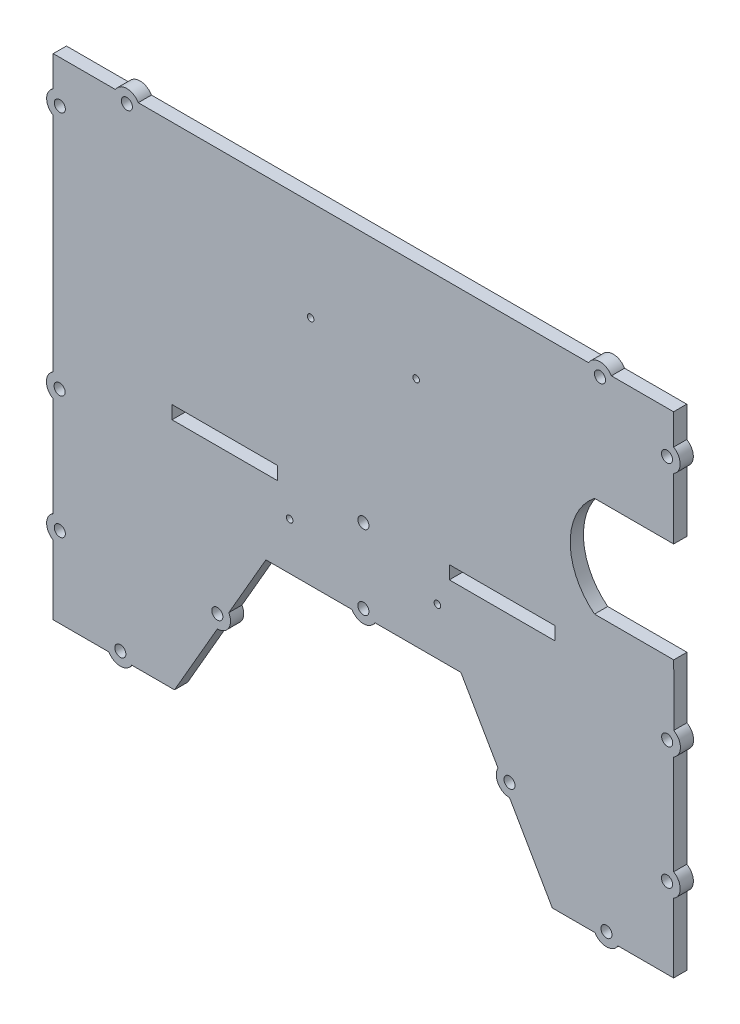
from build123d import *

# Parameters (mm, degrees)
BOSS_EXTRUDE2_DEPTH  = 5
CUT_EXTRUDE1_START   = -5
CUT_EXTRUDE1_DEPTH   = 5
BOSS_EXTRUDE4_DEPTH  = 5
BOSS_EXTRUDE6_DEPTH  = 5
SKETCH7_R            = 2.1
CUT_EXTRUDE3_DEPTH   = 5
CUT_EXTRUDE7_START   = -5
CUT_EXTRUDE7_DEPTH   = 5
BOSS_EXTRUDE9_START  = -5
BOSS_EXTRUDE9_DEPTH  = 5
CUT_EXTRUDE10_DEPTH  = 5
SKETCH18_R           = 2.1
BOSS_EXTRUDE12_DEPTH = 5
BOSS_EXTRUDE13_DEPTH = 5
SKETCH21_W           = 5
SKETCH21_H           = 8.660255075
BOSS_EXTRUDE15_DEPTH = 0.3
CUT_EXTRUDE12_DEPTH  = 5
BOSS_EXTRUDE16_DEPTH = 5
BOSS_EXTRUDE17_DEPTH = 5
CUT_EXTRUDE13_DEPTH  = 5
SKETCH26_R           = 2.1
CUT_EXTRUDE14_DEPTH  = 5
CUT_EXTRUDE15_DEPTH  = 5
SKETCH28_R           = 2.1
BOSS_EXTRUDE18_DEPTH = 5
BOSS_EXTRUDE22_START = -5
BOSS_EXTRUDE22_DEPTH = 5
SKETCH31_R           = 2.1
CUT_EXTRUDE16_DEPTH  = 5
CUT_EXTRUDE17_DEPTH  = 5
SKETCH33_R           = 5
BOSS_EXTRUDE23_DEPTH = 5
SKETCH34_R           = 2.1
CUT_EXTRUDE18_DEPTH  = 5
SKETCH35_R           = 2.1
SKETCH35_W           = 40
SKETCH35_H           = 5
CUT_EXTRUDE19_DEPTH  = 5
SKETCH36_W           = 5
SKETCH36_H           = 84.289880446
BOSS_EXTRUDE24_DEPTH = 15
SKETCH38_R           = 1.25
CUT_EXTRUDE20_DEPTH  = 15
CUT_EXTRUDE22_DEPTH  = 15
SKETCH41_W           = 235.10328775
SKETCH41_H           = 5
CUT_EXTRUDE23_DEPTH  = 5
SKETCH42_W           = 21.47370592
SKETCH42_H           = 11.045026483
CUT_EXTRUDE24_DEPTH  = 5
BOSS_EXTRUDE25_DEPTH = 5
SKETCH44_R           = 2.1
CUT_EXTRUDE25_DEPTH  = 5


with BuildPart() as part:
    # Sketch1 → Boss-Extrude2 (new body)
    with BuildSketch(Plane.XY):
        with BuildLine():
            Line((-117.909641201, -61.899813743), (-117.909641201, -75.46379791))
            ThreePointArc((-117.909641201, -75.46379791), (-120.409641201, -79.793924929), (-117.909641201, -84.124051948))
            Line((-117.909641201, -84.124051948), (-117.909641201, -97.688036115))
            Line((-117.909641201, -97.688036115), (-104.194704325, -106.486172223))
            ThreePointArc((-104.194704325, -106.486172223), (-101.899920025, -110.928464988), (-96.905389489, -111.162269871))
            Line((-96.905389489, -111.162269871), (-86.732726665, -117.688036115))
            Line((-86.732726665, -117.688036115), (-46.516437834, -117.688036115))
            ThreePointArc((-46.516437834, -117.688036115), (-42.186310815, -120.188036115), (-37.856183796, -117.688036115))
            Line((-37.856183796, -117.688036115), (37.176901394, -117.688036115))
            ThreePointArc((37.176901394, -117.688036115), (41.507028413, -120.188036115), (45.837155432, -117.688036115))
            Line((45.837155432, -117.688036115), (86.053444263, -117.688036115))
            Line((86.053444263, -117.688036115), (96.226107086, -111.162269871))
            ThreePointArc((96.226107086, -111.162269871), (101.220637622, -110.928464988), (103.515421923, -106.486172223))
            Line((103.515421923, -106.486172223), (117.230358799, -97.688036115))
            Line((117.230358799, -97.688036115), (117.230358799, -84.124051948))
            ThreePointArc((117.230358799, -84.124051948), (119.730358799, -79.793924929), (117.230358799, -75.46379791))
            Line((117.230358799, -75.46379791), (117.230358799, -61.899813743))
            ThreePointArc((117.230358799, -61.899813743), (115.765892705, -58.364279837), (112.230358799, -56.899813743))
            Line((112.230358799, -56.899813743), (107.230252822, -56.899813743))
            ThreePointArc((107.230252822, -56.899813743), (103.694756385, -55.435385117), (102.230252824, -51.89991972))
            Line((102.230252824, -51.89991972), (102.22876914, 18.10008028))
            ThreePointArc((102.22876914, 18.10008028), (103.693197764, 21.635682694), (107.228769139, 23.100186257))
            Line((107.228769139, 23.100186257), (112.224422266, 23.100186257))
            ThreePointArc((112.224422266, 23.100186257), (115.761454601, 24.566151415), (117.224420469, 28.104425352))
            Line((117.224420469, 28.104425352), (117.198504049, 58.672752041))
            ThreePointArc((117.198504049, 58.672752041), (119.694832884, 63.004997571), (117.19116172, 67.333004004))
            Line((117.19116172, 67.333004004), (117.165248894, 97.897091598))
            ThreePointArc((117.165248894, 97.897091598), (115.8233862, 102.892284122), (112.165252488, 106.548867445))
            Line((112.165252488, 106.548867445), (88.414612972, 120.261305563))
            ThreePointArc((88.414612972, 120.261305563), (86.002803423, 121.260309788), (83.414612972, 121.601051525))
            Line((83.414612972, 121.601051525), (-84.093895374, 121.601051525))
            ThreePointArc((-84.093895374, 121.601051525), (-86.682085825, 121.260309788), (-89.093895374, 120.261305563))
            Line((-89.093895374, 120.261305563), (-112.84453489, 106.548867445))
            ThreePointArc((-112.84453489, 106.548867445), (-116.502668602, 102.892284122), (-117.844531296, 97.897091598))
            Line((-117.844531296, 97.897091598), (-117.870444122, 67.333004004))
            ThreePointArc((-117.870444122, 67.333004004), (-120.374115287, 63.004997571), (-117.877786452, 58.672752041))
            Line((-117.877786452, 58.672752041), (-117.903702872, 28.104425352))
            ThreePointArc((-117.903702872, 28.104425352), (-116.440737003, 24.566151415), (-112.903704669, 23.100186257))
            Line((-112.903704669, 23.100186257), (-107.908051541, 23.100186257))
            ThreePointArc((-107.908051541, 23.100186257), (-104.372480167, 21.635682694), (-102.908051542, 18.10008028))
            Line((-102.908051542, 18.10008028), (-102.909535226, -51.89991972))
            ThreePointArc((-102.909535226, -51.89991972), (-104.374038788, -55.435385117), (-107.909535225, -56.899813743))
            Line((-107.909535225, -56.899813743), (-112.909641201, -56.899813743))
            ThreePointArc((-112.909641201, -56.899813743), (-116.445175107, -58.364279837), (-117.909641201, -61.899813743))
        make_face()
    extrude(amount=BOSS_EXTRUDE2_DEPTH)

    # Sketch2 → Cut-Extrude1 (cut)
    with BuildSketch(Plane.XY.offset(5).offset(CUT_EXTRUDE1_START)):
        with BuildLine():
            Line((82.551631294, 83.23178077), (112.19953348, 66.114556461))
            ThreePointArc((112.19953348, 66.114556461), (115.857667192, 62.457973139), (117.199529886, 57.462780614))
            Line((117.199529886, 57.462780614), (117.198504049, 58.672752041))
            ThreePointArc((117.198504049, 58.672752041), (119.694832884, 63.004997571), (117.19116172, 67.333004004))
            Line((117.19116172, 67.333004004), (117.165248894, 97.897091598))
            ThreePointArc((117.165248894, 97.897091598), (115.8233862, 102.892284122), (112.165252488, 106.548867445))
            Line((112.165252488, 106.548867445), (88.414612972, 120.261305563))
            ThreePointArc((88.414612972, 120.261305563), (86.002803423, 121.260309788), (83.414612972, 121.601051525))
            Line((83.414612972, 121.601051525), (-84.093895374, 121.601051525))
            ThreePointArc((-84.093895374, 121.601051525), (-86.682085825, 121.260309788), (-89.093895374, 120.261305563))
            Line((-89.093895374, 120.261305563), (-112.84453489, 106.548867445))
            ThreePointArc((-112.84453489, 106.548867445), (-116.502668602, 102.892284122), (-117.844531296, 97.897091598))
            Line((-117.844531296, 97.897091598), (-117.870444122, 67.333004004))
            ThreePointArc((-117.870444122, 67.333004004), (-120.374115287, 63.004997571), (-117.877786452, 58.672752041))
            Line((-117.877786452, 58.672752041), (-117.878812289, 57.462780614))
            ThreePointArc((-117.878812289, 57.462780614), (-116.536949595, 62.457973139), (-112.878815883, 66.114556461))
            Line((-112.878815883, 66.114556461), (-83.230913696, 83.23178077))
            ThreePointArc((-83.230913696, 83.23178077), (-80.819104147, 84.230784995), (-78.230913696, 84.571526732))
            Line((-78.230913696, 84.571526732), (77.551631294, 84.571526732))
            ThreePointArc((77.551631294, 84.571526732), (80.139821745, 84.230784995), (82.551631294, 83.23178077))
        make_face()
    extrude(amount=CUT_EXTRUDE1_DEPTH, mode=Mode.SUBTRACT)

    # Sketch5 → Boss-Extrude4 (add)
    with BuildSketch(Plane.XY.offset(5)):
        Polygon((117.224420469, 28.104425352), (117.230358799, -61.899813743), (97.020135534, -61.899813743), (97.020135534, 28.104425352), align=None)
        Polygon((-117.903702872, 28.104425352), (-117.909641201, -61.899813743), (-99.161276446, -61.899813743), (-99.161276446, 28.104425352), align=None)
    extrude(amount=-BOSS_EXTRUDE4_DEPTH)


with BuildPart() as boss_extrude6_tool:
    # Sketch6 → Boss-Extrude6 (new body)
    with BuildSketch(Plane.XY.offset(5)):
        with BuildLine():
            Line((117.229676096, -51.549775852), (117.229104854, -42.889521827))
            ThreePointArc((117.229104854, -42.889521827), (119.729390475, -47.219483936), (117.229676096, -51.549775852))
        make_face()
        with BuildLine():
            Line((-117.908958499, -51.549775852), (-117.908387257, -42.889521827))
            ThreePointArc((-117.908387257, -42.889521827), (-120.408672878, -47.219483936), (-117.908958499, -51.549775852))
        make_face()
    extrude(amount=-BOSS_EXTRUDE6_DEPTH)


with BuildPart() as part_1:
    add(part.part)


with BuildPart() as part_2:
    # Boss-Extrude6: joined with boss_extrude6_tool
    add(part_1.part.fuse(boss_extrude6_tool.part, tol=0.00001))

    # Sketch7 → Cut-Extrude3 (cut)
    with BuildSketch(Plane.XY.offset(5)):
        with Locations((-115.408672889, -47.219813743)):
            Circle(SKETCH7_R)
        with Locations((114.729390486, -47.219813743)):
            Circle(SKETCH7_R)
    extrude(amount=-CUT_EXTRUDE3_DEPTH, mode=Mode.SUBTRACT)

    # Sketch12 → Cut-Extrude7 (cut)
    with BuildSketch(Plane.XY.offset(5).offset(CUT_EXTRUDE7_START)):
        with BuildLine():
            Line((-80.430890219, 57.295225551), (-117.878981263, 57.263476303))
            Line((-117.878981263, 57.263476303), (-117.878812289, 57.462780614))
            ThreePointArc((-117.878812289, 57.462780614), (-116.536949595, 62.457973139), (-112.878815883, 66.114556461))
            Line((-112.878815883, 66.114556461), (-83.230913696, 83.23178077))
            ThreePointArc((-83.230913696, 83.23178077), (-80.819104147, 84.230784995), (-78.230913696, 84.571526732))
            Line((-78.230913696, 84.571526732), (77.551631294, 84.571526732))
            ThreePointArc((77.551631294, 84.571526732), (80.139821745, 84.230784995), (82.551631294, 83.23178077))
            Line((82.551631294, 83.23178077), (112.19953348, 66.114556461))
            ThreePointArc((112.19953348, 66.114556461), (115.857667192, 62.457973139), (117.199529886, 57.462780614))
            Line((117.199529886, 57.462780614), (77.975136294, 57.429525381))
            Line((77.975136294, 57.429525381), (-80.430890219, 57.295225551))
        make_face()
    extrude(amount=CUT_EXTRUDE7_DEPTH, mode=Mode.SUBTRACT)

    # Boss-Extrude9: read off the stored shape, not the designer's step
    # Boss-Extrude9 outline → Boss-Extrude9 (add)
    with BuildSketch(Plane.XY.offset(5).offset(BOSS_EXTRUDE9_START)):
        with BuildLine():
            Line((-117.909641201, -97.688036115), (-117.909641201, -147.554211412))
            Line((-117.909641201, -147.554211412), (-57.839641201, -147.554211412))
            Line((-57.839641201, -147.554211412), (-27.973465904, -117.688036115))
            Line((-27.973465904, -117.688036115), (-37.856183796, -117.688036115))
            ThreePointArc((-37.856183796, -117.688036115), (-42.186310815, -120.188036115), (-46.516437834, -117.688036115))
            Line((-46.516437834, -117.688036115), (-86.732726665, -117.688036115))
            Line((-86.732726665, -117.688036115), (-96.905389489, -111.162269871))
            ThreePointArc((-96.905389489, -111.162269871), (-101.899920025, -110.928464988), (-104.194704325, -106.486172223))
            Line((-104.194704325, -106.486172223), (-117.909641201, -97.688036115))
        make_face()
        with BuildLine():
            Line((-83.230913696, 83.23178077), (-112.878815883, 66.114556461))
            ThreePointArc((-112.878815883, 66.114556461), (-116.536949595, 62.457973139), (-117.878812289, 57.462780614))
            Line((-117.878812289, 57.462780614), (-117.878981263, 57.263476303))
            Line((-117.878981263, 57.263476303), (117.199529886, 57.462780614))
            ThreePointArc((117.199529886, 57.462780614), (115.857667192, 62.457973139), (112.19953348, 66.114556461))
            Line((112.19953348, 66.114556461), (82.551631294, 83.23178077))
            ThreePointArc((82.551631294, 83.23178077), (80.139821745, 84.230784995), (77.551631294, 84.571526732))
            Line((77.551631294, 84.571526732), (-78.230913696, 84.571526732))
            ThreePointArc((-78.230913696, 84.571526732), (-80.819104147, 84.230784995), (-83.230913696, 83.23178077))
        make_face()
    extrude(amount=BOSS_EXTRUDE9_DEPTH)

    # Sketch17 → Cut-Extrude10 (cut)
    with BuildSketch(Plane.XY.offset(5)):
        with BuildLine():
            Line((-117.909641201, -84.124051948), (-117.909641201, -75.46379791))
            ThreePointArc((-117.909641201, -75.46379791), (-120.409641201, -79.793924929), (-117.909641201, -84.124051948))
        make_face()
        with BuildLine():
            Line((-117.908958323, -51.549775852), (-117.908387257, -42.889521827))
            ThreePointArc((-117.908387257, -42.889521827), (-120.408672878, -47.219484012), (-117.908958323, -51.549775852))
        make_face()
        with BuildLine():
            Line((117.229104531, -42.889521827), (117.229676096, -51.549775852))
            ThreePointArc((117.229676096, -51.549775852), (119.729390475, -47.219483796), (117.229104531, -42.889521827))
        make_face()
        with BuildLine():
            Line((117.230358799, -75.46379791), (117.230358799, -84.124051948))
            ThreePointArc((117.230358799, -84.124051948), (119.730358799, -79.793924929), (117.230358799, -75.46379791))
        make_face()
    extrude(amount=-CUT_EXTRUDE10_DEPTH, mode=Mode.SUBTRACT)

    # Sketch18 → Boss-Extrude12 (add)
    with BuildSketch(Plane.XY.offset(5)):
        with Locations((114.729390486, -47.219813743)):
            Circle(SKETCH18_R)
        with Locations((-115.408672889, -47.219813743)):
            Circle(SKETCH18_R)
    extrude(amount=-BOSS_EXTRUDE12_DEPTH)

    # Sketch19 → Boss-Extrude13 (add)
    with BuildSketch(Plane.XY.offset(5)):
        with BuildLine():
            Line((-117.908033697, -37.535691027), (-117.908609204, -46.258353482))
            ThreePointArc((-117.908609204, -46.258353482), (-120.463165041, -41.89685369), (-117.908033697, -37.535691027))
        make_face()
        with BuildLine():
            Line((-117.892209168, 41.795033425), (-117.899551497, 33.134781462))
            ThreePointArc((-117.899551497, 33.134781462), (-120.395880333, 37.467026992), (-117.892209168, 41.795033425))
        make_face()
        with BuildLine():
            ThreePointArc((117.212926765, 41.795033425), (119.71659793, 37.467026992), (117.220269095, 33.134781462))
            Line((117.220269095, 33.134781462), (117.212926765, 41.795033425))
        make_face()
        with BuildLine():
            Line((117.280209688, -37.564938053), (117.287552017, -46.225190016))
            ThreePointArc((117.287552017, -46.225190016), (119.783880852, -41.892944486), (117.280209688, -37.564938053))
        make_face()
        with BuildLine():
            Line((117.230358799, -100.329973207), (117.230358799, -108.990227245))
            ThreePointArc((117.230358799, -108.990227245), (119.730358799, -104.660100226), (117.230358799, -100.329973207))
        make_face()
        with BuildLine():
            Line((-117.909641201, -100.329973207), (-117.909641201, -108.990227245))
            ThreePointArc((-117.909641201, -108.990227245), (-120.409641201, -104.660100226), (-117.909641201, -100.329973207))
        make_face()
    extrude(amount=-BOSS_EXTRUDE13_DEPTH)


with BuildPart() as boss_extrude13_piece_1:
    # of the separate pieces the step leaves, piece 1, a body of its own (boss_extrude13_pieces)
    add(part_2.part.solids().sort_by_distance((-117.878981263, 57.263476303, 0))[0])



with BuildPart() as boss_extrude13_piece_2:
    # of the separate pieces the step leaves, piece 2, a body of its own (boss_extrude13_pieces)
    add(part_2.part.solids().sort_by_distance((117.212926765, 41.795033425, 5))[0])


with BuildPart() as boss_extrude13_piece_3:
    # of the separate pieces the step leaves, piece 3, a body of its own (boss_extrude13_pieces)
    add(part_2.part.solids().sort_by_distance((-117.892209168, 41.795033425, 5))[0])


with BuildPart() as boss_extrude13_piece_4:
    # of the separate pieces the step leaves, piece 4, a body of its own (boss_extrude13_pieces)
    add(part_2.part.solids().sort_by_distance((117.280209688, -37.564938053, 5))[0])


with BuildPart() as boss_extrude13_piece_5:
    # of the separate pieces the step leaves, piece 5, a body of its own (boss_extrude13_pieces)
    add(part_2.part.solids().sort_by_distance((117.230358799, -100.329973207, 5))[0])


with BuildPart() as boss_extrude13_piece_1_1:
    add(boss_extrude13_piece_1.part)

    add(boss_extrude13_piece_4.part)  # Boss-Extrude15 merges Boss-Extrude13 piece 4
    # Sketch21 → Boss-Extrude15 (add)
    with BuildSketch(Plane(origin=(117.248277127, 0.099405362, 0), x_dir=(0, 0, 1), z_dir=(-0.999999640601339, -0.0008478190804545042, 0))):
        with Locations((2.5, -41.99448449)):
            Rectangle(SKETCH21_W, SKETCH21_H)
    extrude(amount=BOSS_EXTRUDE15_DEPTH)

    # Sketch23 → Boss-Extrude16 (add)
    with BuildSketch(Plane.XY.offset(5)):
        with BuildLine():
            Line((117.220155691, 33.134715862), (117.212813251, 41.795098832))
            ThreePointArc((117.212813251, 41.795098832), (119.71659793, 37.467026992), (117.220155691, 33.134715862))
        make_face()
        with BuildLine():
            Line((-117.892095653, 41.795098832), (-117.899438094, 33.134715862))
            ThreePointArc((-117.899438094, 33.134715862), (-120.395880333, 37.467026992), (-117.892095653, 41.795098832))
        make_face()
    extrude(amount=-BOSS_EXTRUDE16_DEPTH)


    add(boss_extrude13_piece_5.part)  # Boss-Extrude17 merges Boss-Extrude13 piece 5
    # Sketch24 → Boss-Extrude17 (add)
    with BuildSketch(Plane.XY.offset(5)):
        with BuildLine():
            Line((103.515421923, -106.486172223), (117.230358799, -97.688036115))
            Line((117.230358799, -97.688036115), (117.230358799, -145.602272977))
            Line((117.230358799, -145.602272977), (71.251792179, -145.602272977))
            Line((71.251792179, -145.602272977), (55.17186758, -117.688036115))
            Line((55.17186758, -117.688036115), (86.053444263, -117.688036115))
            Line((86.053444263, -117.688036115), (96.226107086, -111.162269871))
            ThreePointArc((96.226107086, -111.162269871), (101.220637622, -110.928464988), (103.515421923, -106.486172223))
        make_face()
    extrude(amount=-BOSS_EXTRUDE17_DEPTH)

    # Sketch25 → Cut-Extrude13 (cut)
    with BuildSketch(Plane(origin=(0, 0, 0), x_dir=(-1, 0, 0), z_dir=(0, 0, -1))):
        Polygon((-36.610776027, -85.602272977), (37.290058429, -85.602272977), (71.93107458, -145.602272977), (117.909641201, -145.602272977), (117.909641201, -153.53940599), (-71.251792179, -153.53940599), (-71.251792179, -145.602272977), align=None)
    extrude(amount=-CUT_EXTRUDE13_DEPTH, mode=Mode.SUBTRACT)

    # Sketch26 → Cut-Extrude14 (cut)
    with BuildSketch(Plane.XY.offset(5)):
        with Locations((114.716599727, 37.462787896)):
            Circle(SKETCH26_R)
        with Locations((114.783882649, -41.897183582)):
            Circle(SKETCH26_R)
        with Locations((114.730358799, -104.660100226)):
            Circle(SKETCH26_R)
        with Locations((-115.409641201, -104.660100226)):
            Circle(SKETCH26_R)
        with Locations((-115.463165052, -41.897183582)):
            Circle(SKETCH26_R)
        with Locations((-115.39588213, 37.462787896)):
            Circle(SKETCH26_R)
    extrude(amount=-CUT_EXTRUDE14_DEPTH, mode=Mode.SUBTRACT)

    # Sketch27 → Cut-Extrude15 (cut)
    with BuildSketch(Plane.XY.offset(5)):
        with BuildLine():
            Line((-117.892095653, 41.795098832), (-117.899438094, 33.134715862))
            ThreePointArc((-117.899438094, 33.134715862), (-120.395880333, 37.467026992), (-117.892095653, 41.795098832))
        make_face()
        with BuildLine():
            Line((-117.908033697, -37.535691027), (-117.908609204, -46.258353482))
            ThreePointArc((-117.908609204, -46.258353482), (-120.463165041, -41.89685369), (-117.908033697, -37.535691027))
        make_face()
        with BuildLine():
            Line((-117.909641201, -100.329973207), (-117.909641201, -108.990227245))
            ThreePointArc((-117.909641201, -108.990227245), (-120.409641201, -104.660100226), (-117.909641201, -100.329973207))
        make_face()
        with BuildLine():
            Line((117.230358799, -108.990227245), (117.230358799, -100.329973207))
            ThreePointArc((117.230358799, -100.329973207), (119.730358799, -104.660100226), (117.230358799, -108.990227245))
        make_face()
        with BuildLine():
            Line((117.287552017, -46.225190016), (117.280209688, -37.564938053))
            ThreePointArc((117.280209688, -37.564938053), (119.783880852, -41.892944486), (117.287552017, -46.225190016))
        make_face()
        with BuildLine():
            Line((117.220155691, 33.134715862), (117.212813251, 41.795098832))
            ThreePointArc((117.212813251, 41.795098832), (119.71659793, 37.467026992), (117.220155691, 33.134715862))
        make_face()
    extrude(amount=-CUT_EXTRUDE15_DEPTH, mode=Mode.SUBTRACT)

    # Sketch28 → Boss-Extrude18 (add)
    with BuildSketch(Plane.XY.offset(5)):
        with Locations((114.716599727, 37.462787896)):
            Circle(SKETCH28_R)
        with Locations((114.783882649, -41.897183582)):
            Circle(SKETCH28_R)
        with Locations((114.730358799, -104.660100226)):
            Circle(SKETCH28_R)
        with Locations((-115.409641201, -104.660100226)):
            Circle(SKETCH28_R)
        with Locations((-115.463165052, -41.897183582)):
            Circle(SKETCH28_R)
        with Locations((-115.39588213, 37.462787896)):
            Circle(SKETCH28_R)
    extrude(amount=-BOSS_EXTRUDE18_DEPTH)


with BuildPart() as cut_extrude12_tool:
    # Sketch22 → Cut-Extrude12 (new body)
    with BuildSketch(Plane.XY.offset(5)):
        with BuildLine():
            Line((117.212926765, 41.795033425), (117.220269095, 33.134781462))
            ThreePointArc((117.220269095, 33.134781462), (119.71659793, 37.467026992), (117.212926765, 41.795033425))
        make_face()
        with BuildLine():
            Line((-117.899551497, 33.134781462), (-117.892209168, 41.795033425))
            ThreePointArc((-117.892209168, 41.795033425), (-120.395880333, 37.467026992), (-117.899551497, 33.134781462))
        make_face()
    extrude(amount=-CUT_EXTRUDE12_DEPTH)


with BuildPart() as boss_extrude13_piece_2_1:
    add(boss_extrude13_piece_2.part)

    # Cut-Extrude12: cut by cut_extrude12_tool
    add(cut_extrude12_tool.part, mode=Mode.SUBTRACT)


with BuildPart() as boss_extrude13_piece_3_1:
    add(boss_extrude13_piece_3.part)

    # Cut-Extrude12: cut by cut_extrude12_tool
    add(cut_extrude12_tool.part, mode=Mode.SUBTRACT)


with BuildPart() as boss_extrude22_tool:
    # Boss-Extrude22: read off the stored shape, not the designer's step
    # Boss-Extrude22 outline → Boss-Extrude22 (new body)
    with BuildSketch(Plane.XY.offset(5).offset(BOSS_EXTRUDE22_START)):
        with BuildLine():
            ThreePointArc((117.224955254, 19.998970189), (119.711277501, 24.320722052), (117.225732273, 28.642920844))
            Line((117.225732273, 28.642920844), (117.224420469, 28.104425352))
            ThreePointArc((117.224420469, 28.104425352), (117.224421744, 28.102470751), (117.224422255, 28.100516149))
            Line((117.224422255, 28.100516149), (117.224955254, 19.998970189))
        make_face()
        with BuildLine():
            Line((117.230358799, -110.767851006), (117.230358799, -119.428105044))
            ThreePointArc((117.230358799, -119.428105044), (119.730358799, -115.097978025), (117.230358799, -110.767851006))
        make_face()
        with BuildLine():
            ThreePointArc((87.45523178, -145.602272977), (91.785358799, -148.102272977), (96.115485818, -145.602272977))
            Line((96.115485818, -145.602272977), (87.45523178, -145.602272977))
        make_face()
        with BuildLine():
            Line((55.024839537, -117.496366549), (50.694712518, -109.996366549))
            ThreePointArc((50.694712518, -109.996366549), (50.694712517, -114.996366549), (55.024839537, -117.496366549))
        make_face()
        with BuildLine():
            ThreePointArc((-117.909641201, -110.767145958), (-120.409641201, -115.097272977), (-117.909641201, -119.427399996))
            Line((-117.909641201, -119.427399996), (-117.909641201, -110.767145958))
        make_face()
        with BuildLine():
            ThreePointArc((-96.79476822, -145.602272977), (-92.464641201, -148.102272977), (-88.134514182, -145.602272977))
            Line((-88.134514182, -145.602272977), (-96.79476822, -145.602272977))
        make_face()
        with BuildLine():
            ThreePointArc((-55.704121939, -117.496366549), (-51.37399492, -114.996366549), (-51.37399492, -109.996366549))
            Line((-51.37399492, -109.996366549), (-55.704121939, -117.496366549))
        make_face()
        with BuildLine():
            ThreePointArc((-4.669559606, -85.602272977), (-0.339432587, -88.102272977), (3.990694432, -85.602272977))
            Line((3.990694432, -85.602272977), (-4.669559606, -85.602272977))
        make_face()
        with BuildLine():
            Line((-117.903702872, 28.104425352), (-117.903241172, 28.648998661))
            ThreePointArc((-117.903241172, 28.648998661), (-120.399261875, 24.321747367), (-117.904237989, 19.993921248))
            Line((-117.904237989, 19.993921248), (-117.903704658, 28.100516149))
            ThreePointArc((-117.903704658, 28.100516149), (-117.903704147, 28.102470751), (-117.903702872, 28.104425352))
        make_face()
    extrude(amount=BOSS_EXTRUDE22_DEPTH)


with BuildPart() as boss_extrude13_piece_1_2:
    add(boss_extrude13_piece_1_1.part)


with BuildPart() as boss_extrude13_piece_1_3:
    # Boss-Extrude22: joined with boss_extrude22_tool
    add(boss_extrude13_piece_1_2.part.fuse(boss_extrude22_tool.part, tol=0.00001))

    # Sketch31 → Cut-Extrude16 (cut)
    with BuildSketch(Plane.XY.offset(5)):
        with Locations((-115.399261908, 24.32117151)):
            Circle(SKETCH31_R)
        with Locations((-92.464641201, -143.102272977)):
            Circle(SKETCH31_R)
        with Locations((-55.704121939, -112.496366549)):
            Circle(SKETCH31_R)
        with Locations((-0.339432587, -83.102272977)):
            Circle(SKETCH31_R)
        with Locations((55.024839536, -112.496366549)):
            Circle(SKETCH31_R)
        with Locations((114.730358799, -115.097978025)):
            Circle(SKETCH31_R)
        with Locations((114.711277521, 24.32117151)):
            Circle(SKETCH31_R)
        with Locations((91.785358799, -143.102272977)):
            Circle(SKETCH31_R)
        with Locations((-115.409641201, -115.097272977)):
            Circle(SKETCH31_R)
    extrude(amount=-CUT_EXTRUDE16_DEPTH, mode=Mode.SUBTRACT)

    # Sketch32 → Cut-Extrude17 (cut)
    with BuildSketch(Plane.XY.offset(5)):
        with BuildLine():
            Line((-117.889165528, 45.25117151), (-79.540559924, 45.25117151))
            Line((-79.540559924, 45.25117151), (117.209883125, 45.25117151))
            Line((117.209883125, 45.25117151), (117.199529886, 57.462780614))
            ThreePointArc((117.199529886, 57.462780614), (115.857667192, 62.457973139), (112.19953348, 66.114556461))
            Line((112.19953348, 66.114556461), (82.551631294, 83.23178077))
            ThreePointArc((82.551631294, 83.23178077), (80.139821745, 84.230784995), (77.551631294, 84.571526732))
            Line((77.551631294, 84.571526732), (-78.230913696, 84.571526732))
            ThreePointArc((-78.230913696, 84.571526732), (-80.819104147, 84.230784995), (-83.230913696, 83.23178077))
            Line((-83.230913696, 83.23178077), (-112.878815883, 66.114556461))
            ThreePointArc((-112.878815883, 66.114556461), (-116.536949595, 62.457973139), (-117.878812289, 57.462780614))
            Line((-117.878812289, 57.462780614), (-117.889165528, 45.25117151))
        make_face()
    extrude(amount=-CUT_EXTRUDE17_DEPTH, mode=Mode.SUBTRACT)

    # Sketch33 → Boss-Extrude23 (add)
    with BuildSketch(Plane.XY.offset(5)):
        with Locations((114.808231898, -68.665098892)):
            Circle(SKETCH33_R)
        with Locations((-115.487097072, -68.665098892)):
            Circle(SKETCH33_R)
    extrude(amount=-BOSS_EXTRUDE23_DEPTH)

    # Sketch34 → Cut-Extrude18 (cut)
    with BuildSketch(Plane.XY.offset(5)):
        with Locations((-115.487097072, -68.665098892)):
            Circle(SKETCH34_R)
        with Locations((114.808231898, -68.665098892)):
            Circle(SKETCH34_R)
    extrude(amount=-CUT_EXTRUDE18_DEPTH, mode=Mode.SUBTRACT)

    # Sketch35 → Cut-Extrude19 (cut)
    with BuildSketch(Plane.XY.offset(5)):
        with Locations((-0.325135338, -54.922272977)):
            Circle(SKETCH35_R)
        with Locations((-52.880135338, -54.922272977)):
            Rectangle(SKETCH35_W, SKETCH35_H)
        with Locations((52.229864662, -54.922272977)):
            Rectangle(SKETCH35_W, SKETCH35_H)
    extrude(amount=-CUT_EXTRUDE19_DEPTH, mode=Mode.SUBTRACT)

    # Sketch36 → Boss-Extrude24 (add)
    with BuildSketch(Plane(origin=(117.248277127, 0.099405362, 0), x_dir=(0, 0, -1), z_dir=(0.999999640601339, 0.0008478190804503918, 0))):
        with Locations((-2.5, -22.245362775)):
            Rectangle(SKETCH36_W, SKETCH36_H)
    extrude(amount=-BOSS_EXTRUDE24_DEPTH)

    # Sketch38 → Cut-Extrude20 (cut)
    with BuildSketch(Plane.XY.offset(5)):
        with Locations((19.67048227, 2.30323698)):
            Circle(SKETCH38_R)
        with Locations((-20.329514673, 2.287600163)):
            Circle(SKETCH38_R)
        with Locations((27.697846088, -67.693630309)):
            Circle(SKETCH38_R)
        with Locations((-28.302149633, -67.715521852)):
            Circle(SKETCH38_R)
    extrude(amount=-CUT_EXTRUDE20_DEPTH, mode=Mode.SUBTRACT)

    # Sketch39 → Cut-Extrude22 (cut)
    with BuildSketch(Plane.XY.offset(5)):
        with BuildLine():
            Line((117.251028602, -3.145949418), (87.251028602, -3.145949418))
            ThreePointArc((87.251028602, -3.145949418), (78.049715414, -22.145949418), (87.251028602, -41.145949418))
            Line((87.251028602, -41.145949418), (117.251028602, -41.145949418))
            Line((117.251028602, -41.145949418), (120.145365357, -41.145949418))
            Line((120.145365357, -41.145949418), (120.145365357, -3.145949418))
            Line((120.145365357, -3.145949418), (117.251028602, -3.145949418))
        make_face()
    extrude(amount=-CUT_EXTRUDE22_DEPTH, mode=Mode.SUBTRACT)

    # Sketch41 → Cut-Extrude23 (cut)
    with BuildSketch(Plane.XY.offset(5)):
        with Locations((-0.34176075, 42.75117151)):
            Rectangle(SKETCH41_W, SKETCH41_H)
    extrude(amount=-CUT_EXTRUDE23_DEPTH, mode=Mode.SUBTRACT)

    # Sketch42 → Cut-Extrude24 (cut)
    with BuildSketch(Plane.XY.offset(5)):
        with Locations((120.751971747, 45.773684751)):
            Rectangle(SKETCH42_W, SKETCH42_H)
    extrude(amount=-CUT_EXTRUDE24_DEPTH, mode=Mode.SUBTRACT)

    # Sketch43 → Boss-Extrude25 (add)
    with BuildSketch(Plane.XY.offset(5)):
        with BuildLine():
            Line((84.985802274, 40.244067356), (93.646056311, 40.244067356))
            ThreePointArc((93.646056311, 40.244067356), (89.315929292, 42.744067356), (84.985802274, 40.244067356))
        make_face()
        with BuildLine():
            Line((-94.325326668, 40.244067356), (-85.66507263, 40.244067356))
            ThreePointArc((-85.66507263, 40.244067356), (-89.995199649, 42.744067356), (-94.325326668, 40.244067356))
        make_face()
    extrude(amount=-BOSS_EXTRUDE25_DEPTH)

    # Sketch44 → Cut-Extrude25 (cut)
    with BuildSketch(Plane.XY.offset(5)):
        with Locations((-89.995199649, 37.744067356)):
            Circle(SKETCH44_R)
        with Locations((89.315929292, 37.744067356)):
            Circle(SKETCH44_R)
    extrude(amount=-CUT_EXTRUDE25_DEPTH, mode=Mode.SUBTRACT)


solid = boss_extrude13_piece_1_3.part
